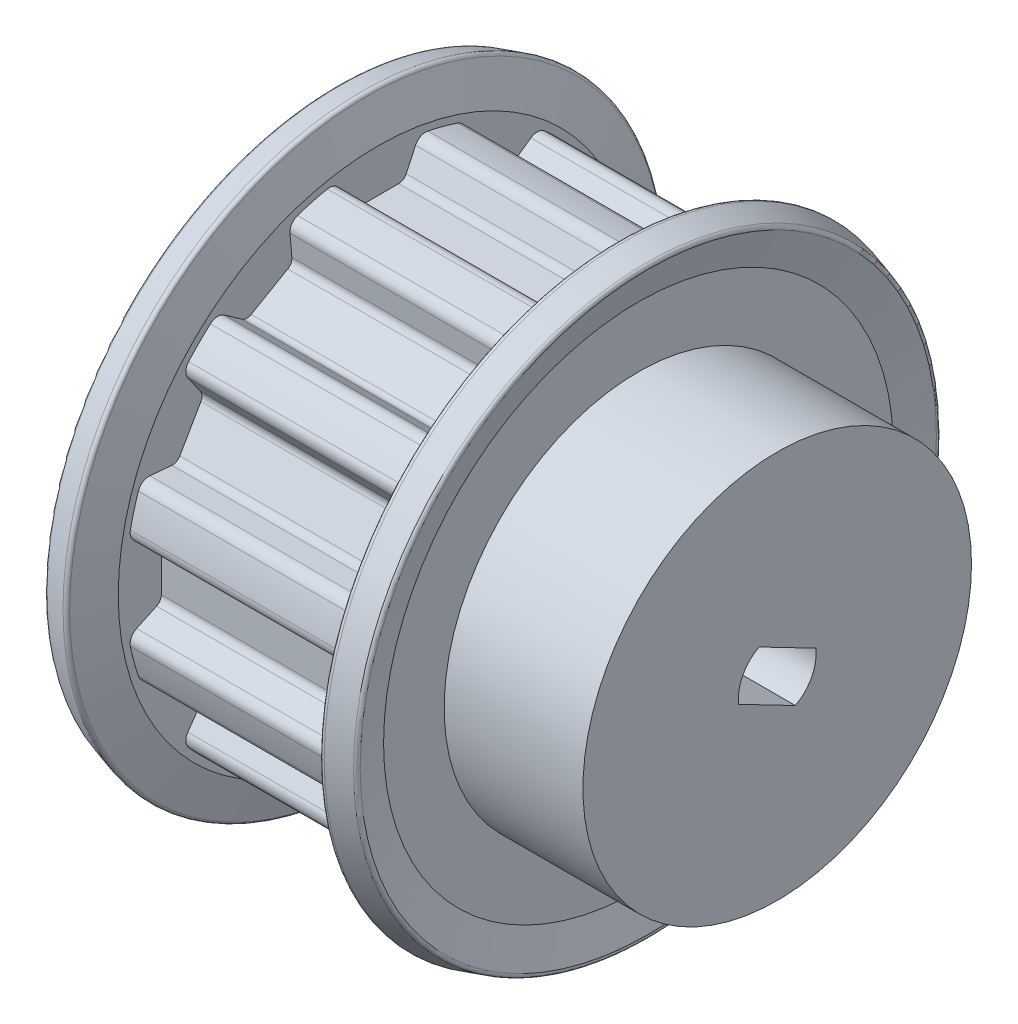
from build123d import *

# Parameters (mm, degrees)
WYTNIJ_WYCI_GNI_CIE1_DEPTH = 41.269855351
SZYK_KO_OWY1_COUNT         = 12
ZAOKR_GLENIE1_R            = 0.25
PODZIEL3_START             = -31
PODZIEL3_OUTLINE_R         = 13.5
PODZIEL3_DEPTH             = 2.2
PODZIEL4_START             = -12.2
PODZIEL4_OUTLINE_R         = 13.5
PODZIEL4_DEPTH             = 2.2
SKETCH1_R                  = 3
BOSS_EXTRUDE1_DEPTH        = 31


# Read off the part's stored shape, not the designer's step: Podziel3, Podziel4
with BuildPart() as part:
    # Szkic1 → 31 T10/12/2F (revolve)
    with BuildSketch(Plane.XY, mode=Mode.PRIVATE) as f_31_t10_12_2f_sk:
        Polygon((0, 3), (0, 14), (-10, 14), (-10, 18.175), (-31, 18.175), (-31, 3), align=None)
    revolve(f_31_t10_12_2f_sk.sketch.rotate(Axis((0, 0, 0), (-1, 0, 0)), 90), axis=Axis((0, 0, 0), (-1, 0, 0)))

    # Szkic2 → Wytnij-wyciągnięcie1 (cut, symmetric)
    with BuildSketch(Plane.ZY.offset(31)):
        with BuildLine():
            Line((-95.878294595, -0.955389606), (-3.622784307, 17.810279584))
            ThreePointArc((-3.622784307, 17.810279584), (-3.103228648, 17.740709099), (-2.738275769, 17.364427912))
            Line((-2.738275769, 17.364427912), (-2.065394346, 15.921429043))
            ThreePointArc((-2.065394346, 15.921429043), (-1.843989439, 15.668965133), (-1.521609673, 15.575))
            Line((-1.521609673, 15.575), (1.521609673, 15.575))
            ThreePointArc((1.521609673, 15.575), (1.843989439, 15.668965133), (2.065394346, 15.921429043))
            Line((2.065394346, 15.921429043), (2.738275769, 17.364427912))
            ThreePointArc((2.738275769, 17.364427912), (3.103228648, 17.740709099), (3.622784307, 17.810279584))
            Line((3.622784307, 17.810279584), (95.878294595, -0.955389606))
            Line((95.878294595, -0.955389606), (95.878294595, 187.334063298))
            Line((95.878294595, 187.334063298), (-95.878294595, 187.334063298))
            Line((-95.878294595, 187.334063298), (-95.878294595, -0.955389606))
        make_face()
    wytnij_wyci_gni_cie1 = extrude(amount=WYTNIJ_WYCI_GNI_CIE1_DEPTH, both=True, mode=Mode.SUBTRACT)

    # Szyk kołowy1: Wytnij-wyciągnięcie1 ×12 about axis
    szyk_ko_owy1_axis = Axis((0, 0, 0), (1, 0, 0))
    for i in range(1, SZYK_KO_OWY1_COUNT):
        add(wytnij_wyci_gni_cie1.rotate(szyk_ko_owy1_axis, i * 360 / SZYK_KO_OWY1_COUNT), mode=Mode.SUBTRACT)

    # Podziel3 outline → Podziel3 (cut)
    with BuildSketch(Plane.YZ.offset(PODZIEL3_START)):
        with BuildLine():
            ThreePointArc((11.053630335, -13.668897809), (11.557829392, -13.812290437), (12.042563034, -13.612762415))
            ThreePointArc((12.042563034, -13.612762415), (12.851665748, -12.851665748), (13.612762415, -12.042563034))
            ThreePointArc((13.612762415, -12.042563034), (13.812290437, -11.557829392), (13.668897809, -11.053630335))
            Line((13.668897809, -11.053630335), (12.755664843, -9.749398494))
            ThreePointArc((12.755664843, -9.749398494), (12.647727137, -9.431424265), (12.727540827, -9.105252632))
            Line((12.727540827, -9.105252632), (14.249150501, -6.469747368))
            ThreePointArc((14.249150501, -6.469747368), (14.491716575, -6.237540868), (14.821059189, -6.172030549))
            Line((14.821059189, -6.172030549), (16.407173579, -6.310797577))
            ThreePointArc((16.407173579, -6.310797577), (16.915519085, -6.182879707), (17.235546722, -5.76771655))
            ThreePointArc((17.235546722, -5.76771655), (17.555701893, -4.704036145), (17.810279584, -3.622784307))
            ThreePointArc((17.810279584, -3.622784307), (17.740709099, -3.103228648), (17.364427912, -2.738275769))
            Line((17.364427912, -2.738275769), (15.921429043, -2.065394346))
            ThreePointArc((15.921429043, -2.065394346), (15.668965133, -1.843989438), (15.575, -1.521609673))
            Line((15.575, -1.521609673), (15.575, 1.521609673))
            ThreePointArc((15.575, 1.521609673), (15.668965133, 1.843989438), (15.921429043, 2.065394346))
            Line((15.921429043, 2.065394346), (17.364427912, 2.738275769))
            ThreePointArc((17.364427912, 2.738275769), (17.740709099, 3.103228648), (17.810279584, 3.622784307))
            ThreePointArc((17.810279584, 3.622784307), (17.555701893, 4.704036145), (17.235546722, 5.76771655))
            ThreePointArc((17.235546722, 5.76771655), (16.915519085, 6.182879707), (16.407173579, 6.310797577))
            Line((16.407173579, 6.310797577), (14.821059189, 6.172030549))
            ThreePointArc((14.821059189, 6.172030549), (14.491716575, 6.237540868), (14.249150501, 6.469747368))
            Line((14.249150501, 6.469747368), (12.727540827, 9.105252632))
            ThreePointArc((12.727540827, 9.105252632), (12.647727137, 9.431424265), (12.755664843, 9.749398494))
            Line((12.755664843, 9.749398494), (13.668897809, 11.053630335))
            ThreePointArc((13.668897809, 11.053630335), (13.812290437, 11.557829392), (13.612762415, 12.042563034))
            ThreePointArc((13.612762415, 12.042563034), (12.851665748, 12.851665748), (12.042563034, 13.612762415))
            ThreePointArc((12.042563034, 13.612762415), (11.557829392, 13.812290437), (11.053630335, 13.668897809))
            Line((11.053630335, 13.668897809), (9.749398494, 12.755664843))
            ThreePointArc((9.749398494, 12.755664843), (9.431424265, 12.647727137), (9.105252632, 12.727540827))
            Line((9.105252632, 12.727540827), (6.469747368, 14.249150501))
            ThreePointArc((6.469747368, 14.249150501), (6.237540868, 14.491716575), (6.172030549, 14.821059189))
            Line((6.172030549, 14.821059189), (6.310797577, 16.407173579))
            ThreePointArc((6.310797577, 16.407173579), (6.182879707, 16.915519085), (5.76771655, 17.235546722))
            ThreePointArc((5.76771655, 17.235546722), (4.704036145, 17.555701893), (3.622784307, 17.810279584))
            ThreePointArc((3.622784307, 17.810279584), (3.103228648, 17.740709099), (2.738275769, 17.364427912))
            Line((2.738275769, 17.364427912), (2.065394346, 15.921429043))
            ThreePointArc((2.065394346, 15.921429043), (1.843989438, 15.668965133), (1.521609673, 15.575))
            Line((1.521609673, 15.575), (-1.521609673, 15.575))
            ThreePointArc((-1.521609673, 15.575), (-1.843989438, 15.668965133), (-2.065394346, 15.921429043))
            Line((-2.065394346, 15.921429043), (-2.738275769, 17.364427912))
            ThreePointArc((-2.738275769, 17.364427912), (-3.103228648, 17.740709099), (-3.622784307, 17.810279584))
            ThreePointArc((-3.622784307, 17.810279584), (-4.704036145, 17.555701893), (-5.76771655, 17.235546722))
            ThreePointArc((-5.76771655, 17.235546722), (-6.182879707, 16.915519085), (-6.310797577, 16.407173579))
            Line((-6.310797577, 16.407173579), (-6.172030549, 14.821059189))
            ThreePointArc((-6.172030549, 14.821059189), (-6.237540868, 14.491716575), (-6.469747368, 14.249150501))
            Line((-6.469747368, 14.249150501), (-9.105252632, 12.727540827))
            ThreePointArc((-9.105252632, 12.727540827), (-9.431424265, 12.647727137), (-9.749398494, 12.755664843))
            Line((-9.749398494, 12.755664843), (-11.053630335, 13.668897809))
            ThreePointArc((-11.053630335, 13.668897809), (-11.557829392, 13.812290437), (-12.042563034, 13.612762415))
            ThreePointArc((-12.042563034, 13.612762415), (-12.851665748, 12.851665748), (-13.612762415, 12.042563034))
            ThreePointArc((-13.612762415, 12.042563034), (-13.812290437, 11.557829392), (-13.668897809, 11.053630335))
            Line((-13.668897809, 11.053630335), (-12.755664843, 9.749398494))
            ThreePointArc((-12.755664843, 9.749398494), (-12.647727137, 9.431424265), (-12.727540827, 9.105252632))
            Line((-12.727540827, 9.105252632), (-14.249150501, 6.469747368))
            ThreePointArc((-14.249150501, 6.469747368), (-14.491716575, 6.237540868), (-14.821059189, 6.172030549))
            Line((-14.821059189, 6.172030549), (-16.407173579, 6.310797577))
            ThreePointArc((-16.407173579, 6.310797577), (-16.915519085, 6.182879707), (-17.235546722, 5.76771655))
            ThreePointArc((-17.235546722, 5.76771655), (-17.555701893, 4.704036145), (-17.810279584, 3.622784307))
            ThreePointArc((-17.810279584, 3.622784307), (-17.740709099, 3.103228648), (-17.364427912, 2.738275769))
            Line((-17.364427912, 2.738275769), (-15.921429043, 2.065394346))
            ThreePointArc((-15.921429043, 2.065394346), (-15.668965133, 1.843989438), (-15.575, 1.521609673))
            Line((-15.575, 1.521609673), (-15.575, -1.521609673))
            ThreePointArc((-15.575, -1.521609673), (-15.668965133, -1.843989438), (-15.921429043, -2.065394346))
            Line((-15.921429043, -2.065394346), (-17.364427912, -2.738275769))
            ThreePointArc((-17.364427912, -2.738275769), (-17.740709099, -3.103228648), (-17.810279584, -3.622784307))
            ThreePointArc((-17.810279584, -3.622784307), (-17.555701893, -4.704036145), (-17.235546722, -5.76771655))
            ThreePointArc((-17.235546722, -5.76771655), (-16.915519085, -6.182879707), (-16.407173579, -6.310797577))
            Line((-16.407173579, -6.310797577), (-14.821059189, -6.172030549))
            ThreePointArc((-14.821059189, -6.172030549), (-14.491716575, -6.237540868), (-14.249150501, -6.469747368))
            Line((-14.249150501, -6.469747368), (-12.727540827, -9.105252632))
            ThreePointArc((-12.727540827, -9.105252632), (-12.647727137, -9.431424265), (-12.755664843, -9.749398494))
            Line((-12.755664843, -9.749398494), (-13.668897809, -11.053630335))
            ThreePointArc((-13.668897809, -11.053630335), (-13.812290437, -11.557829392), (-13.612762415, -12.042563034))
            ThreePointArc((-13.612762415, -12.042563034), (-12.851665748, -12.851665748), (-12.042563034, -13.612762415))
            ThreePointArc((-12.042563034, -13.612762415), (-11.557829392, -13.812290437), (-11.053630335, -13.668897809))
            Line((-11.053630335, -13.668897809), (-9.749398494, -12.755664843))
            ThreePointArc((-9.749398494, -12.755664843), (-9.431424265, -12.647727137), (-9.105252632, -12.727540827))
            Line((-9.105252632, -12.727540827), (-6.469747368, -14.249150501))
            ThreePointArc((-6.469747368, -14.249150501), (-6.237540868, -14.491716575), (-6.172030549, -14.821059189))
            Line((-6.172030549, -14.821059189), (-6.310797577, -16.407173579))
            ThreePointArc((-6.310797577, -16.407173579), (-6.182879707, -16.915519085), (-5.76771655, -17.235546722))
            ThreePointArc((-5.76771655, -17.235546722), (-4.704036145, -17.555701893), (-3.622784307, -17.810279584))
            ThreePointArc((-3.622784307, -17.810279584), (-3.103228648, -17.740709099), (-2.738275769, -17.364427912))
            Line((-2.738275769, -17.364427912), (-2.065394346, -15.921429043))
            ThreePointArc((-2.065394346, -15.921429043), (-1.843989438, -15.668965133), (-1.521609673, -15.575))
            Line((-1.521609673, -15.575), (1.521609673, -15.575))
            ThreePointArc((1.521609673, -15.575), (1.843989438, -15.668965133), (2.065394346, -15.921429043))
            Line((2.065394346, -15.921429043), (2.738275769, -17.364427912))
            ThreePointArc((2.738275769, -17.364427912), (3.103228648, -17.740709099), (3.622784307, -17.810279584))
            ThreePointArc((3.622784307, -17.810279584), (4.704036145, -17.555701893), (5.76771655, -17.235546722))
            ThreePointArc((5.76771655, -17.235546722), (6.182879707, -16.915519085), (6.310797577, -16.407173579))
            Line((6.310797577, -16.407173579), (6.172030549, -14.821059189))
            ThreePointArc((6.172030549, -14.821059189), (6.237540868, -14.491716575), (6.469747368, -14.249150501))
            Line((6.469747368, -14.249150501), (9.105252632, -12.727540827))
            ThreePointArc((9.105252632, -12.727540827), (9.431424265, -12.647727137), (9.749398494, -12.755664843))
            Line((9.749398494, -12.755664843), (11.053630335, -13.668897809))
        make_face()
        Circle(PODZIEL3_OUTLINE_R, mode=Mode.SUBTRACT)
    extrude(amount=PODZIEL3_DEPTH, mode=Mode.SUBTRACT)

    # Podziel4 outline → Podziel4 (cut)
    with BuildSketch(Plane.YZ.offset(PODZIEL4_START)):
        with BuildLine():
            ThreePointArc((17.235546722, -5.76771655), (17.555701893, -4.704036145), (17.810279584, -3.622784307))
            ThreePointArc((17.810279584, -3.622784307), (17.740709099, -3.103228648), (17.364427912, -2.738275769))
            Line((17.364427912, -2.738275769), (15.921429043, -2.065394346))
            ThreePointArc((15.921429043, -2.065394346), (15.668965133, -1.843989438), (15.575, -1.521609673))
            Line((15.575, -1.521609673), (15.575, 1.521609673))
            ThreePointArc((15.575, 1.521609673), (15.668965133, 1.843989438), (15.921429043, 2.065394346))
            Line((15.921429043, 2.065394346), (17.364427912, 2.738275769))
            ThreePointArc((17.364427912, 2.738275769), (17.740709099, 3.103228648), (17.810279584, 3.622784307))
            ThreePointArc((17.810279584, 3.622784307), (17.555701893, 4.704036145), (17.235546722, 5.76771655))
            ThreePointArc((17.235546722, 5.76771655), (16.915519085, 6.182879707), (16.407173579, 6.310797577))
            Line((16.407173579, 6.310797577), (14.821059189, 6.172030549))
            ThreePointArc((14.821059189, 6.172030549), (14.491716575, 6.237540868), (14.249150501, 6.469747368))
            Line((14.249150501, 6.469747368), (12.727540827, 9.105252632))
            ThreePointArc((12.727540827, 9.105252632), (12.647727137, 9.431424265), (12.755664843, 9.749398494))
            Line((12.755664843, 9.749398494), (13.668897809, 11.053630335))
            ThreePointArc((13.668897809, 11.053630335), (13.812290437, 11.557829392), (13.612762415, 12.042563034))
            ThreePointArc((13.612762415, 12.042563034), (12.851665748, 12.851665748), (12.042563034, 13.612762415))
            ThreePointArc((12.042563034, 13.612762415), (11.557829392, 13.812290437), (11.053630335, 13.668897809))
            Line((11.053630335, 13.668897809), (9.749398494, 12.755664843))
            ThreePointArc((9.749398494, 12.755664843), (9.431424265, 12.647727137), (9.105252632, 12.727540827))
            Line((9.105252632, 12.727540827), (6.469747368, 14.249150501))
            ThreePointArc((6.469747368, 14.249150501), (6.237540868, 14.491716575), (6.172030549, 14.821059189))
            Line((6.172030549, 14.821059189), (6.310797577, 16.407173579))
            ThreePointArc((6.310797577, 16.407173579), (6.182879707, 16.915519085), (5.76771655, 17.235546722))
            ThreePointArc((5.76771655, 17.235546722), (4.704036145, 17.555701893), (3.622784307, 17.810279584))
            ThreePointArc((3.622784307, 17.810279584), (3.103228648, 17.740709099), (2.738275769, 17.364427912))
            Line((2.738275769, 17.364427912), (2.065394346, 15.921429043))
            ThreePointArc((2.065394346, 15.921429043), (1.843989438, 15.668965133), (1.521609673, 15.575))
            Line((1.521609673, 15.575), (-1.521609673, 15.575))
            ThreePointArc((-1.521609673, 15.575), (-1.843989438, 15.668965133), (-2.065394346, 15.921429043))
            Line((-2.065394346, 15.921429043), (-2.738275769, 17.364427912))
            ThreePointArc((-2.738275769, 17.364427912), (-3.103228648, 17.740709099), (-3.622784307, 17.810279584))
            ThreePointArc((-3.622784307, 17.810279584), (-4.704036145, 17.555701893), (-5.76771655, 17.235546722))
            ThreePointArc((-5.76771655, 17.235546722), (-6.182879707, 16.915519085), (-6.310797577, 16.407173579))
            Line((-6.310797577, 16.407173579), (-6.172030549, 14.821059189))
            ThreePointArc((-6.172030549, 14.821059189), (-6.237540868, 14.491716575), (-6.469747368, 14.249150501))
            Line((-6.469747368, 14.249150501), (-9.105252632, 12.727540827))
            ThreePointArc((-9.105252632, 12.727540827), (-9.431424265, 12.647727137), (-9.749398494, 12.755664843))
            Line((-9.749398494, 12.755664843), (-11.053630335, 13.668897809))
            ThreePointArc((-11.053630335, 13.668897809), (-11.557829392, 13.812290437), (-12.042563034, 13.612762415))
            ThreePointArc((-12.042563034, 13.612762415), (-12.851665748, 12.851665748), (-13.612762415, 12.042563034))
            ThreePointArc((-13.612762415, 12.042563034), (-13.812290437, 11.557829392), (-13.668897809, 11.053630335))
            Line((-13.668897809, 11.053630335), (-12.755664843, 9.749398494))
            ThreePointArc((-12.755664843, 9.749398494), (-12.647727137, 9.431424265), (-12.727540827, 9.105252632))
            Line((-12.727540827, 9.105252632), (-14.249150501, 6.469747368))
            ThreePointArc((-14.249150501, 6.469747368), (-14.491716575, 6.237540868), (-14.821059189, 6.172030549))
            Line((-14.821059189, 6.172030549), (-16.407173579, 6.310797577))
            ThreePointArc((-16.407173579, 6.310797577), (-16.915519085, 6.182879707), (-17.235546722, 5.76771655))
            ThreePointArc((-17.235546722, 5.76771655), (-17.555701893, 4.704036145), (-17.810279584, 3.622784307))
            ThreePointArc((-17.810279584, 3.622784307), (-17.740709099, 3.103228648), (-17.364427912, 2.738275769))
            Line((-17.364427912, 2.738275769), (-15.921429043, 2.065394346))
            ThreePointArc((-15.921429043, 2.065394346), (-15.668965133, 1.843989438), (-15.575, 1.521609673))
            Line((-15.575, 1.521609673), (-15.575, -1.521609673))
            ThreePointArc((-15.575, -1.521609673), (-15.668965133, -1.843989438), (-15.921429043, -2.065394346))
            Line((-15.921429043, -2.065394346), (-17.364427912, -2.738275769))
            ThreePointArc((-17.364427912, -2.738275769), (-17.740709099, -3.103228648), (-17.810279584, -3.622784307))
            ThreePointArc((-17.810279584, -3.622784307), (-17.555701893, -4.704036145), (-17.235546722, -5.76771655))
            ThreePointArc((-17.235546722, -5.76771655), (-16.915519085, -6.182879707), (-16.407173579, -6.310797577))
            Line((-16.407173579, -6.310797577), (-14.821059189, -6.172030549))
            ThreePointArc((-14.821059189, -6.172030549), (-14.491716575, -6.237540868), (-14.249150501, -6.469747368))
            Line((-14.249150501, -6.469747368), (-12.727540827, -9.105252632))
            ThreePointArc((-12.727540827, -9.105252632), (-12.647727137, -9.431424265), (-12.755664843, -9.749398494))
            Line((-12.755664843, -9.749398494), (-13.668897809, -11.053630335))
            ThreePointArc((-13.668897809, -11.053630335), (-13.812290437, -11.557829392), (-13.612762415, -12.042563034))
            ThreePointArc((-13.612762415, -12.042563034), (-12.851665748, -12.851665748), (-12.042563034, -13.612762415))
            ThreePointArc((-12.042563034, -13.612762415), (-11.557829392, -13.812290437), (-11.053630335, -13.668897809))
            Line((-11.053630335, -13.668897809), (-9.749398494, -12.755664843))
            ThreePointArc((-9.749398494, -12.755664843), (-9.431424265, -12.647727137), (-9.105252632, -12.727540827))
            Line((-9.105252632, -12.727540827), (-6.469747368, -14.249150501))
            ThreePointArc((-6.469747368, -14.249150501), (-6.237540868, -14.491716575), (-6.172030549, -14.821059189))
            Line((-6.172030549, -14.821059189), (-6.310797577, -16.407173579))
            ThreePointArc((-6.310797577, -16.407173579), (-6.182879707, -16.915519085), (-5.76771655, -17.235546722))
            ThreePointArc((-5.76771655, -17.235546722), (-4.704036145, -17.555701893), (-3.622784307, -17.810279584))
            ThreePointArc((-3.622784307, -17.810279584), (-3.103228648, -17.740709099), (-2.738275769, -17.364427912))
            Line((-2.738275769, -17.364427912), (-2.065394346, -15.921429043))
            ThreePointArc((-2.065394346, -15.921429043), (-1.843989438, -15.668965133), (-1.521609673, -15.575))
            Line((-1.521609673, -15.575), (1.521609673, -15.575))
            ThreePointArc((1.521609673, -15.575), (1.843989438, -15.668965133), (2.065394346, -15.921429043))
            Line((2.065394346, -15.921429043), (2.738275769, -17.364427912))
            ThreePointArc((2.738275769, -17.364427912), (3.103228648, -17.740709099), (3.622784307, -17.810279584))
            ThreePointArc((3.622784307, -17.810279584), (4.704036145, -17.555701893), (5.76771655, -17.235546722))
            ThreePointArc((5.76771655, -17.235546722), (6.182879707, -16.915519085), (6.310797577, -16.407173579))
            Line((6.310797577, -16.407173579), (6.172030549, -14.821059189))
            ThreePointArc((6.172030549, -14.821059189), (6.237540868, -14.491716575), (6.469747368, -14.249150501))
            Line((6.469747368, -14.249150501), (9.105252632, -12.727540827))
            ThreePointArc((9.105252632, -12.727540827), (9.431424265, -12.647727137), (9.749398494, -12.755664843))
            Line((9.749398494, -12.755664843), (11.053630335, -13.668897809))
            ThreePointArc((11.053630335, -13.668897809), (11.557829392, -13.812290437), (12.042563034, -13.612762415))
            ThreePointArc((12.042563034, -13.612762415), (12.851665748, -12.851665748), (13.612762415, -12.042563034))
            ThreePointArc((13.612762415, -12.042563034), (13.812290437, -11.557829392), (13.668897809, -11.053630335))
            Line((13.668897809, -11.053630335), (12.755664843, -9.749398494))
            ThreePointArc((12.755664843, -9.749398494), (12.647727137, -9.431424265), (12.727540827, -9.105252632))
            Line((12.727540827, -9.105252632), (14.249150501, -6.469747368))
            ThreePointArc((14.249150501, -6.469747368), (14.491716575, -6.237540868), (14.821059189, -6.172030549))
            Line((14.821059189, -6.172030549), (16.407173579, -6.310797577))
            ThreePointArc((16.407173579, -6.310797577), (16.915519085, -6.182879707), (17.235546722, -5.76771655))
        make_face()
        Circle(PODZIEL4_OUTLINE_R, mode=Mode.SUBTRACT)
    extrude(amount=PODZIEL4_DEPTH, mode=Mode.SUBTRACT)


with BuildPart() as body_2:
    # Szkic3 → Obrót-cienka ścianka1 (revolve)
    with BuildSketch(Plane.XY, mode=Mode.PRIVATE) as obr_t_cienka_cianka1_sk:
        Polygon((-31, 13.5), (-31, 18.365), (-31.780522559, 21), (-29.671119143, 21.624833758), (-28.8, 18.683984819), (-28.8, 13.5), align=None)
    revolve(obr_t_cienka_cianka1_sk.sketch.rotate(Axis((0, 0, 0), (1, 0, 0)), 90), axis=Axis((0, 0, 0), (1, 0, 0)))

    # Zaokrąglenie1
    zaokr_glenie1_edges = [body_2.edges().sort_by_distance(p)[0] for p in [
        (-29.671119143, 0, -21.624833758),
        (-31.780522559, 0, -21),
    ]]
    fillet(zaokr_glenie1_edges, radius=ZAOKR_GLENIE1_R)


with BuildPart() as body_3:
    # Lustro1: mirrored copy
    add(body_2.part.mirror(Plane.ZY.offset(20.5)))


with BuildPart() as body_2_1:
    add(body_2.part)

    add(part.part)  # Boss-Extrude1 merges part

    add(body_3.part)  # Boss-Extrude1 merges body 3
    # Sketch1 → Boss-Extrude1 (add)
    with BuildSketch(Plane(origin=(0, 0, 0), x_dir=(0, 0, -1), z_dir=(1, 0, 0))):
        Circle(SKETCH1_R)
        with BuildLine():
            Line((-2.776307727, -0.363476827), (1.304109277, -2.477760883))
            ThreePointArc((1.304109277, -2.477760883), (2.486082996, -1.288173644), (2.776307727, 0.363476827))
            Line((2.776307727, 0.363476827), (-1.304109277, 2.477760883))
            ThreePointArc((-1.304109277, 2.477760883), (-1.986244903, 1.973532666), (-2.486082996, 1.288173644))
            ThreePointArc((-2.486082996, 1.288173644), (-2.75774842, 0.48458606), (-2.776307727, -0.363476827))
        make_face(mode=Mode.SUBTRACT)
    extrude(amount=-BOSS_EXTRUDE1_DEPTH)


solid = body_2_1.part
